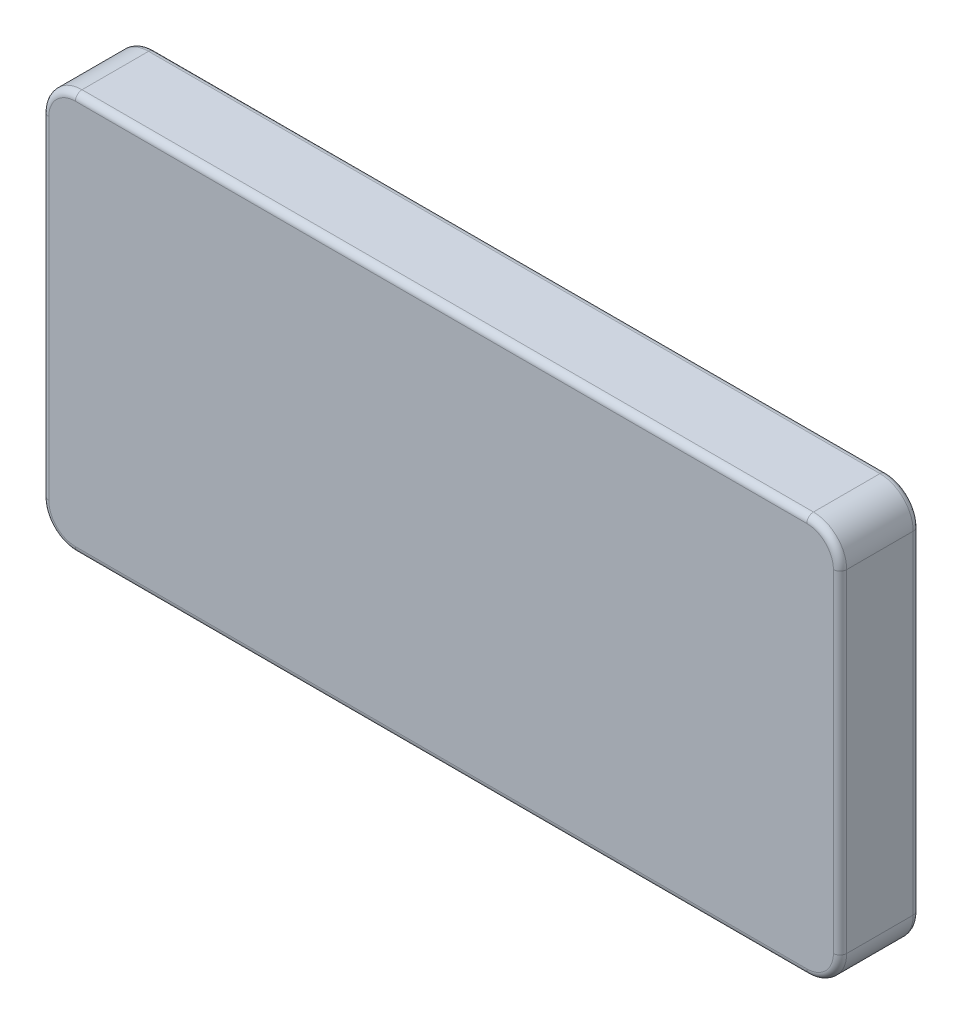
from build123d import *

# Parameters (mm, degrees)
ESQUISSE1_W        = 1200
ESQUISSE1_H        = 600
BOSS_EXTRU_1_DEPTH = 120
CONG_1_R           = 10
CONG_2_R           = 50


with BuildPart() as part:
    # Esquisse1 → Boss.-Extru.1 (new body)
    with BuildSketch(Plane.XY):
        with Locations((600, 300)):
            Rectangle(ESQUISSE1_W, ESQUISSE1_H)
    extrude(amount=BOSS_EXTRU_1_DEPTH)

    # Congé1
    cong_1_edges = [part.edges().sort_by_distance(p)[0] for p in [
        (1200, 300, 120),
        (600, 600, 120),
        (0, 300, 120),
        (600, 600, 0),
        (1200, 300, 0),
        (600, 0, 0),
        (0, 300, 0),
        (600, 0, 120),
    ]]
    fillet(cong_1_edges, radius=CONG_1_R)

    # Congé2
    # the kernel refuses this fillet: 50 mm, written as the material it takes off along each edge
    with BuildSketch(Plane(origin=(50, 550, 0), x_dir=(-1, 0, 0), z_dir=(0, -1, 0))) as cong_2_piece_1:
        with BuildLine():
            CenterArc((40, -10), 10, 0, 90)
            Line((50, -10), (50, 0))
            Line((50, 0), (40, 0))
        make_face()
    revolve(axis=Axis((50, 550, 0), (0, 0, -1)), revolution_arc=90, mode=Mode.SUBTRACT)
    with BuildSketch(Plane(origin=(1150, 550, 0), x_dir=(0, 1, 0), z_dir=(-1, 0, 0))) as cong_2_piece_2:
        with BuildLine():
            CenterArc((40, -10), 10, 0, 90)
            Line((50, -10), (50, 0))
            Line((50, 0), (40, 0))
        make_face()
    revolve(axis=Axis((1150, 550, 0), (0, 0, -1)), revolution_arc=90, mode=Mode.SUBTRACT)
    with BuildSketch(Plane(origin=(50, 50, 0), x_dir=(0, -1, 0), z_dir=(1, 0, 0))) as cong_2_piece_3:
        with BuildLine():
            CenterArc((40, -10), 10, 0, 90)
            Line((50, -10), (50, 0))
            Line((50, 0), (40, 0))
        make_face()
    revolve(axis=Axis((50, 50, 0), (0, 0, -1)), revolution_arc=90, mode=Mode.SUBTRACT)
    with BuildSketch(Plane(origin=(1150, 50, 0), x_dir=(1, 0, 0), z_dir=(0, 1, 0))) as cong_2_piece_4:
        with BuildLine():
            CenterArc((40, -10), 10, 0, 90)
            Line((50, -10), (50, 0))
            Line((50, 0), (40, 0))
        make_face()
    revolve(axis=Axis((1150, 50, 0), (0, 0, -1)), revolution_arc=90, mode=Mode.SUBTRACT)
    with BuildSketch(Plane(origin=(1150, 50, 120), x_dir=(0, -1, 0), z_dir=(-1, 0, 0))) as cong_2_piece_5:
        with BuildLine():
            CenterArc((40, -10), 10, 0, 90)
            Line((50, -10), (50, 0))
            Line((50, 0), (40, 0))
        make_face()
    revolve(axis=Axis((1150, 50, 120), (0, 0, 1)), revolution_arc=90, mode=Mode.SUBTRACT)
    with BuildSketch(Plane(origin=(50, 50, 120), x_dir=(-1, 0, 0), z_dir=(0, 1, 0))) as cong_2_piece_6:
        with BuildLine():
            CenterArc((40, -10), 10, 0, 90)
            Line((50, -10), (50, 0))
            Line((50, 0), (40, 0))
        make_face()
    revolve(axis=Axis((50, 50, 120), (0, 0, 1)), revolution_arc=90, mode=Mode.SUBTRACT)
    with BuildSketch(Plane(origin=(1150, 550, 120), x_dir=(1, 0, 0), z_dir=(0, -1, 0))) as cong_2_piece_7:
        with BuildLine():
            CenterArc((40, -10), 10, 0, 90)
            Line((50, -10), (50, 0))
            Line((50, 0), (40, 0))
        make_face()
    revolve(axis=Axis((1150, 550, 120), (0, 0, 1)), revolution_arc=90, mode=Mode.SUBTRACT)
    with BuildSketch(Plane(origin=(50, 550, 120), x_dir=(0, 1, 0), z_dir=(1, 0, 0))) as cong_2_piece_8:
        with BuildLine():
            CenterArc((40, -10), 10, 0, 90)
            Line((50, -10), (50, 0))
            Line((50, 0), (40, 0))
        make_face()
    revolve(axis=Axis((50, 550, 120), (0, 0, 1)), revolution_arc=90, mode=Mode.SUBTRACT)
    with BuildSketch(Plane(origin=(1200, 0, 0), x_dir=(-1, 0, 0), z_dir=(0, 0, 1)), Plane(origin=(1200, 600, 0), x_dir=(0, -1, 0), z_dir=(0, 0, 1))) as cong_2_piece_9:
        with BuildLine():
            CenterArc((CONG_2_R, -CONG_2_R), CONG_2_R, 90, 90)
            Line((0, -CONG_2_R), (0, 0))
            Line((0, 0), (CONG_2_R, 0))
        make_face()
    extrude(amount=120, mode=Mode.SUBTRACT)
    with BuildSketch(Plane(origin=(0, 0, 0), x_dir=(1, 0, 0), z_dir=(0, 0, 1)), Plane(origin=(0, 600, 0), x_dir=(0, -1, 0), z_dir=(0, 0, 1))) as cong_2_piece_10:
        with BuildLine():
            CenterArc((CONG_2_R, CONG_2_R), CONG_2_R, 180, 90)
            Line((0, CONG_2_R), (0, 0))
            Line((0, 0), (CONG_2_R, 0))
        make_face()
    extrude(amount=120, mode=Mode.SUBTRACT)


solid = part.part
